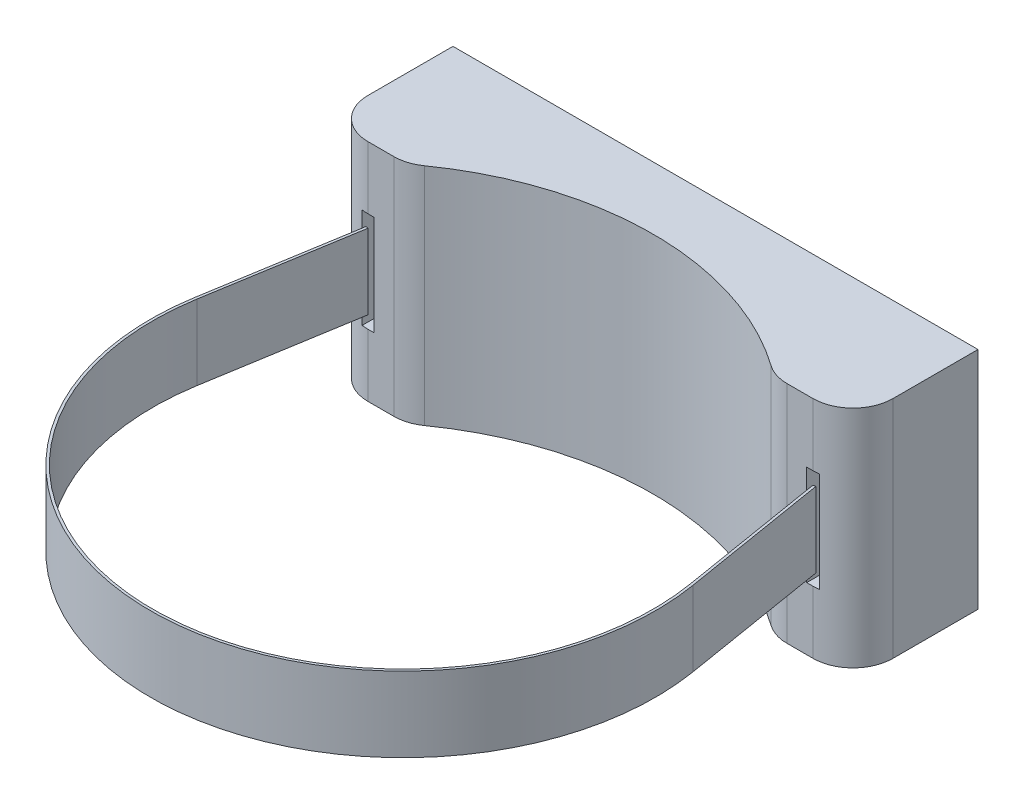
from build123d import *

# Parameters (mm, degrees)
BOSS_EXTRUDE1_DEPTH = 114.3
FILLET1_R           = 20.32
FILLET2_R           = 20.32
SKETCH2_W           = 6.35
SKETCH2_H           = 50.8
CUT_EXTRUDE1_DEPTH  = 187.759102857
EXTRUDE_THIN1_START = 6.35
EXTRUDE_THIN1_DEPTH = 38.1


with BuildPart() as part:
    # Sketch1 → Boss-Extrude1 (new body)
    with BuildSketch(Plane(origin=(0, 0, 0), x_dir=(1, 0, 0), z_dir=(0, 1, 0))):
        with BuildLine():
            Line((-133.35, 31.75), (133.35, 31.75))
            Line((133.35, 31.75), (133.35, -31.75))
            Line((133.35, -31.75), (93.109277196, -31.75))
            ThreePointArc((93.109277196, -31.75), (0, 0), (-93.109277196, -31.75))
            Line((-93.109277196, -31.75), (-133.35, -31.75))
            Line((-133.35, -31.75), (-133.35, 31.75))
        make_face()
    extrude(amount=BOSS_EXTRUDE1_DEPTH)

    # Fillet1
    fillet1_edges = [part.edges().sort_by_distance(p)[0] for p in [
        (133.35, 57.15, 31.75),
        (-133.35, 57.15, 31.75),
    ]]
    fillet(fillet1_edges, radius=FILLET1_R)

    # Fillet2
    fillet2_edges = [part.edges().sort_by_distance(p)[0] for p in [
        (93.109277196, 57.15, 31.75),
        (-93.109277196, 57.15, 31.75),
    ]]
    fillet(fillet2_edges, radius=FILLET2_R)

    # Sketch2 → Cut-Extrude1 (cut, through all)
    with BuildSketch(Plane.XY.offset(31.75)):
        with Locations((-113.03, 57.15)):
            Rectangle(SKETCH2_W, SKETCH2_H)
        with Locations((113.03, 57.15)):
            Rectangle(SKETCH2_W, SKETCH2_H)
    extrude(amount=-CUT_EXTRUDE1_DEPTH, mode=Mode.SUBTRACT)


with BuildPart() as body_2:
    # Sketch3 → Extrude-Thin1 (new body)
    with BuildSketch(Plane(origin=(0, 31.75, 0), x_dir=(1, 0, 0), z_dir=(0, 1, 0)).offset(EXTRUDE_THIN1_START)):
        with BuildLine():
            Line((-113.03, -31.75), (-125.313565249, -106.372097429))
            ThreePointArc((-125.313565249, -106.372097429), (0, -254), (125.313565249, -106.372097429))
            Line((125.313565249, -106.372097429), (113.03, -31.75))
            Line((113.03, -31.75), (114.283135652, -31.543720974))
            Line((114.283135652, -31.543720974), (126.566700902, -106.165818404))
            ThreePointArc((126.566700902, -106.165818404), (0, -255.27), (-126.566700902, -106.165818404))
            Line((-126.566700902, -106.165818404), (-114.283135652, -31.543720974))
            Line((-114.283135652, -31.543720974), (-113.03, -31.75))
        make_face()
    extrude(amount=EXTRUDE_THIN1_DEPTH)


solid = Compound([part.part, body_2.part])
